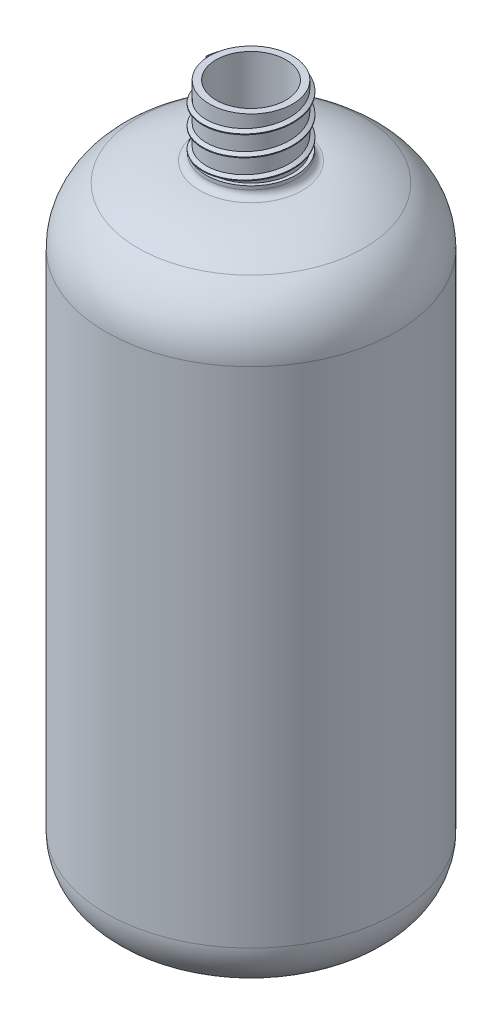
from build123d import *

# Parameters (mm, degrees)
DI_1_PITCH = 6


with BuildPart() as part:
    # Çizim1 → Döndür1 (revolve)
    with BuildSketch(Plane.XY, mode=Mode.PRIVATE) as d_nd_r1_sk:
        with BuildLine():
            Line((0, 0), (-28.5, 0))
            ThreePointArc((-28.5, 0), (-39.106601718, 4.393398282), (-43.5, 15))
            Line((-43.5, 15), (-43.5, 166.180407837))
            ThreePointArc((-43.5, 166.180407837), (-40.949286861, 175.953963385), (-33.947761194, 183.234565278))
            ThreePointArc((-33.947761194, 183.234565278), (-25.035330244, 187.261680302), (-15.402777778, 188.953724575))
            ThreePointArc((-15.402777778, 188.953724575), (-14.051821067, 189.571948024), (-13.5, 190.951360137))
            Line((-13.5, 190.951360137), (-13.5, 192))
            Line((-13.5, 192), (-12.5, 192))
            Line((-12.5, 192), (-12.5, 210))
            Line((-12.5, 210), (0, 210))
            Line((0, 210), (0, 0))
        make_face()
    revolve(d_nd_r1_sk.sketch.rotate(Axis((0, 0, 0), (0, 1, 0)), 270), axis=Axis((0, 0, 0), (0, 1, 0)))

    # İç Boşaltma1: read off the stored shape, not the designer's step
    # İç Boşaltma1 outline → İç Boşaltma1 (revolve, cut)
    with BuildSketch(Plane.XY):
        with BuildLine():
            Line((10.5, 190), (10.5, 210))
            Line((10.5, 210), (0, 210))
            Line((0, 210), (0, 2))
            Line((0, 2), (28.5, 2))
            ThreePointArc((28.5, 2), (37.692388155, 5.807611845), (41.5, 15))
            Line((41.5, 15), (41.5, 166.180407837))
            ThreePointArc((41.5, 166.180407837), (39.204358174, 174.97660783), (32.902985075, 181.529149534))
            ThreePointArc((32.902985075, 181.529149534), (24.445933809, 185.350499557), (15.305555556, 186.956089013))
            ThreePointArc((15.305555556, 186.956089013), (12.954954102, 187.865466202), (11.614782646, 190))
            Line((11.614782646, 190), (10.5, 190))
        make_face()
    revolve(axis=Axis((0, 0, 0), (0, 1, 0)), mode=Mode.SUBTRACT)

    # Diş1: arcs per turn and ends read off the stored shape
    # Diş1: the profile of Diş Profili1 profile screwed along a right-hand helix through 3 turns, 14 arcs to a turn; built about Z, then put on its axis
    di_1_z = Axis((0, 0, 0), (0, 0, 1))
    di_1_corners = [(12.4997, 0, -0.000173205), (13.58253175, 0, 0.624999997), (13.58253175, 0, 0.874999997), (12.4997, 0, 1.5001732)]
    with BuildLine(mode=Mode.PRIVATE) as di_1_profile:
        Line(di_1_corners[0], di_1_corners[1])
        Line(di_1_corners[1], di_1_corners[2])
        Line(di_1_corners[2], di_1_corners[3])
        Line(di_1_corners[3], di_1_corners[0])
    di_1_cap = Face(di_1_profile.wire())
    di_1_turn_angles = [0, 12.857142857, 25.714285714, 38.571428571, 51.428571429, 64.285714286, 77.142857143, 90, 102.857142857, 115.714285714, 128.571428571, 141.428571429, 154.285714286, 167.142857143, 180, 192.857142857, 205.714285714, 218.571428571, 231.428571429, 244.285714286, 257.142857143, 270, 282.857142857, 295.714285714, 308.571428571, 321.428571429, 334.285714286, 347.142857143, 360]
    di_1_turn_weights = [1, 0.9749279121818236, 1, 0.9749279121818236, 1, 0.9749279121818236, 1, 0.9749279121818236, 1, 0.9749279121818236, 1, 0.9749279121818236, 1, 0.9749279121818236, 1, 0.9749279121818236, 1, 0.9749279121818236, 1, 0.9749279121818236, 1, 0.9749279121818236, 1, 0.9749279121818237, 1, 0.9749279121818236, 1, 0.9749279121818236, 1]
    di_1_turn_rails = [Edge.make_bspline([Vector(p[0], p[1], 0).rotate(di_1_z, di_1_turn_angles[k]) / di_1_turn_weights[k] + Vector(0, 0, p[2] + DI_1_PITCH * di_1_turn_angles[k] / 360) for k in range(29)], [0, 0, 0, 1, 1, 2, 2, 3, 3, 4, 4, 5, 5, 6, 6, 7, 7, 8, 8, 9, 9, 10, 10, 11, 11, 12, 12, 13, 13, 14, 14, 14], 2, di_1_turn_weights) for p in di_1_corners]
    di_1_turn_sides = [Face.make_surface_from_curves(di_1_turn_rails[p[0]], di_1_turn_rails[p[1]]) for p in [(0, 1), (1, 2), (2, 3), (3, 0)]]
    di_1 = Plane(origin=(0, 210, 0), x_dir=(-1, 0, 0), z_dir=(0, -1, 0)) * Solid(Shell([*[p.moved(Location((0, 0, DI_1_PITCH * i))) for i in range(3) for p in di_1_turn_sides], di_1_cap, di_1_cap.rotate(di_1_z, 1080).moved(Location((0, 0, DI_1_PITCH * 1080 / 360)))]))
    add(di_1)


solid = part.part
